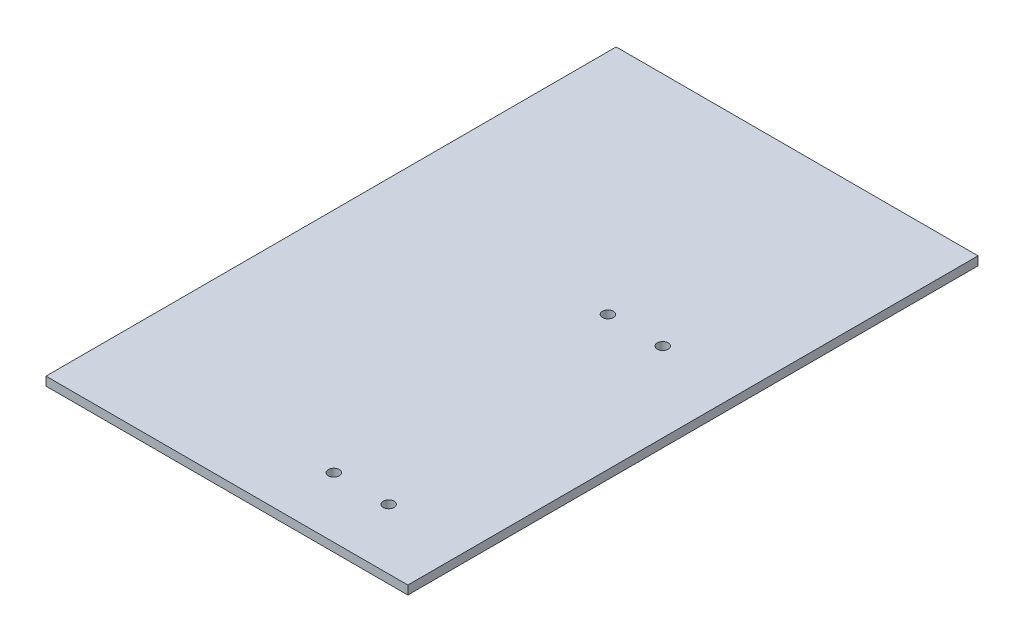
from build123d import *

# Parameters (mm, degrees)
ESQUISSE1_W             = 66
ESQUISSE1_H             = 104
BOSS_EXTRU_1_DEPTH      = 1.5875
ESQUISSE4_R             = 1
ENL_V_MAT_EXTRU_1_DEPTH = 1.5875


with BuildPart() as part:
    # Esquisse1 → Boss.-Extru.1 (new body)
    with BuildSketch(Plane(origin=(0, 0, 0), x_dir=(1, 0, 0), z_dir=(0, 1, 0))):
        Rectangle(ESQUISSE1_W, ESQUISSE1_H)
    extrude(amount=BOSS_EXTRU_1_DEPTH)

    # Esquisse4 → Enlèv. mat.-Extru.1 (cut)
    with BuildSketch(Plane(origin=(0, 1.5875, 0), x_dir=(1, 0, 0), z_dir=(0, 1, 0))):
        with Locations((8.5, 9)):
            Circle(ESQUISSE4_R)
        with Locations((18.5, 9)):
            Circle(ESQUISSE4_R)
        with Locations((18.5, -41)):
            Circle(ESQUISSE4_R)
        with Locations((8.5, -41)):
            Circle(ESQUISSE4_R)
    extrude(amount=-ENL_V_MAT_EXTRU_1_DEPTH, mode=Mode.SUBTRACT)


solid = part.part
